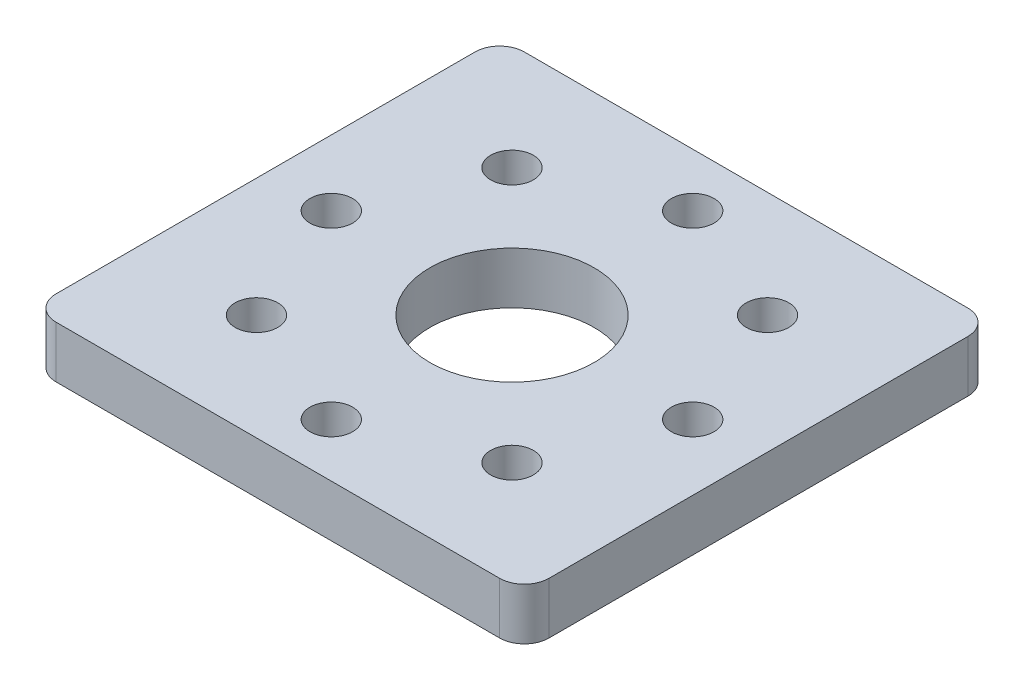
from build123d import *

# Parameters (mm, degrees)
SKETCH1_W           = 30
SKETCH1_H           = 28.5
BOSS_EXTRUDE1_DEPTH = 3.15
SKETCH2_R           = 5
SKETCH2_R_2         = 1.3
CUT_EXTRUDE1_DEPTH  = 21.92809117
FILLET1_R           = 1.5


with BuildPart() as part:
    # Sketch1 → Boss-Extrude1 (new body)
    with BuildSketch(Plane(origin=(0, 0, 0), x_dir=(1, 0, 0), z_dir=(0, 1, 0))):
        Rectangle(SKETCH1_W, SKETCH1_H)
    extrude(amount=-BOSS_EXTRUDE1_DEPTH)

    # Sketch2 → Cut-Extrude1 (cut, through all)
    with BuildSketch(Plane(origin=(0, 0, 0), x_dir=(1, 0, 0), z_dir=(0, 1, 0))):
        Circle(SKETCH2_R)
        with Locations((0, 11)):
            Circle(SKETCH2_R_2)
        with Locations((7.778174593, 7.778174593)):
            Circle(SKETCH2_R_2)
        with Locations((11, 0)):
            Circle(SKETCH2_R_2)
        with Locations((7.778174593, -7.778174593)):
            Circle(SKETCH2_R_2)
        with Locations((0, -11)):
            Circle(SKETCH2_R_2)
        with Locations((-7.778174593, -7.778174593)):
            Circle(SKETCH2_R_2)
        with Locations((-11, 0)):
            Circle(SKETCH2_R_2)
        with Locations((-7.778174593, 7.778174593)):
            Circle(SKETCH2_R_2)
    extrude(amount=-CUT_EXTRUDE1_DEPTH, mode=Mode.SUBTRACT)

    # Fillet1
    fillet1_edges = [part.edges().sort_by_distance(p)[0] for p in [
        (15, -1.575, 14.25),
        (-15, -1.575, 14.25),
        (-15, -1.575, -14.25),
        (15, -1.575, -14.25),
    ]]
    fillet(fillet1_edges, radius=FILLET1_R)


solid = part.part
